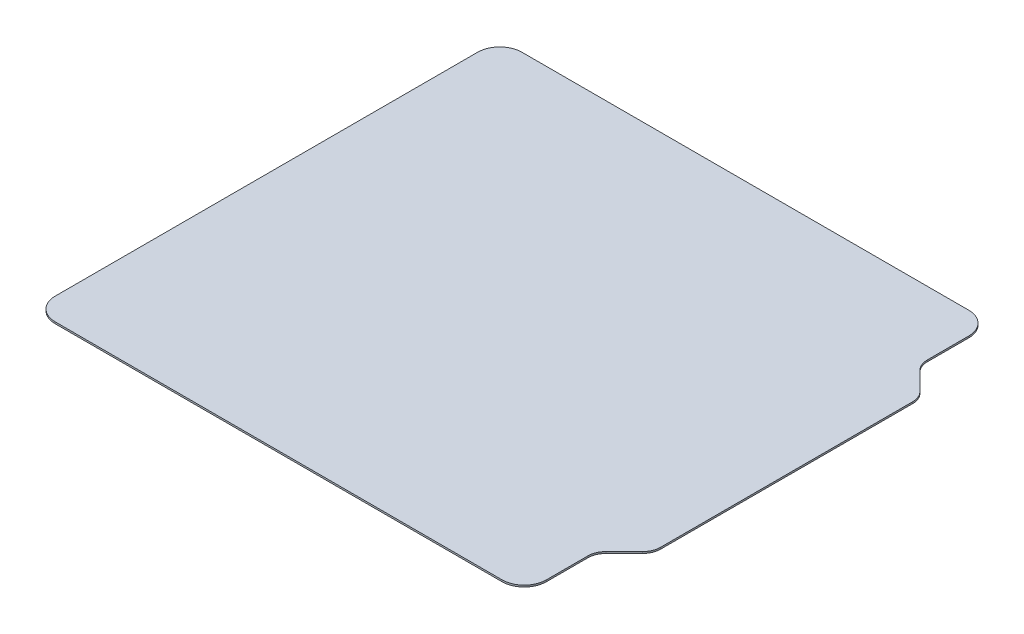
from build123d import *

# Parameters (mm, degrees)
SKETCH1_W           = 234
SKETCH1_H           = 210
BOSS_EXTRUDE1_DEPTH = 0.76
CUT_EXTRUDE1_DEPTH  = 0.76
FILLET1_R           = 8
FILLET2_R           = 10


with BuildPart() as part:
    # Sketch1 → Boss-Extrude1 (new body)
    with BuildSketch(Plane(origin=(0, 0, 0), x_dir=(1, 0, 0), z_dir=(0, 1, 0))):
        Rectangle(SKETCH1_W, SKETCH1_H)
    extrude(amount=BOSS_EXTRUDE1_DEPTH)

    # Sketch2 → Cut-Extrude1 (cut)
    with BuildSketch(Plane(origin=(0, 0.76, 0), x_dir=(1, 0, 0), z_dir=(0, 1, 0))):
        Polygon((117, 60), (104, 73), (104, 105), (117, 105), align=None)
        Polygon((104, -105), (117, -105), (117, -60), (104, -73), align=None)
    extrude(amount=-CUT_EXTRUDE1_DEPTH, mode=Mode.SUBTRACT)

    # Fillet1
    fillet1_edges = [part.edges().sort_by_distance(p)[0] for p in [
        (104, 0.38, 73),
        (117, 0.38, 60),
        (117, 0.38, -60),
        (104, 0.38, -73),
    ]]
    fillet(fillet1_edges, radius=FILLET1_R)

    # Fillet2
    fillet2_edges = [part.edges().sort_by_distance(p)[0] for p in [
        (-117, 0.38, -105),
        (-117, 0.38, 105),
        (104, 0.38, 105),
        (104, 0.38, -105),
    ]]
    fillet(fillet2_edges, radius=FILLET2_R)


solid = part.part
